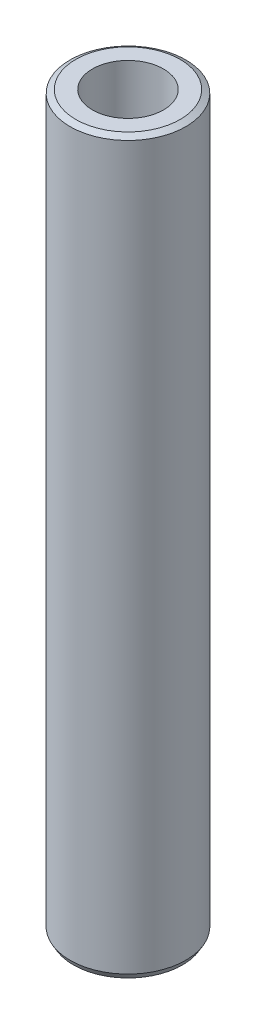
from build123d import *
from OCP.BRepFilletAPI import BRepFilletAPI_MakeChamfer

# Parameters (mm, degrees)
SKETCH1_R           = 47.5
BOSS_EXTRUDE1_DEPTH = 600
SKETCH2_R           = 29.17581862
CUT_EXTRUDE1_DEPTH  = 604.748706003
CHAMFER1_SIZE       = 2.716349708
CHAMFER1_SIZE2      = 4.704855705


with BuildPart() as part:
    # Sketch1 → Boss-Extrude1 (new body)
    with BuildSketch(Plane(origin=(0, 0, 0), x_dir=(1, 0, 0), z_dir=(0, 1, 0))):
        Circle(SKETCH1_R)
    extrude(amount=BOSS_EXTRUDE1_DEPTH)

    # Sketch2 → Cut-Extrude1 (cut, through all)
    with BuildSketch(Plane(origin=(0, 0, 0), x_dir=(1, 0, 0), z_dir=(0, 1, 0))):
        Circle(SKETCH2_R)
    extrude(amount=CUT_EXTRUDE1_DEPTH, mode=Mode.SUBTRACT)

    # Chamfer1: one chamfer whose edges measure the first distance from different faces: ONE call of the kernel's chamfer builder (chamfer() names one face for all edges)
    chamfer1_edges_1 = [part.edges().sort_by_distance(p)[0] for p in [
        (-47.5, 600, 0),
    ]]
    chamfer1_side_1 = [part.faces().sort_by_distance(p)[0] for p in [
        (-47.5, 300, 0),
    ]]
    chamfer1_edges_2 = [part.edges().sort_by_distance(p)[0] for p in [
        (-47.5, 0, 0),
    ]]
    chamfer1_side_2 = [part.faces().sort_by_distance(p)[0] for p in [
        (-46.156497116, 0, 0),
    ]]
    chamfer1 = BRepFilletAPI_MakeChamfer(part.part.solid().wrapped)
    for e in chamfer1_edges_1:
        chamfer1.Add(CHAMFER1_SIZE, CHAMFER1_SIZE2, e.wrapped, chamfer1_side_1[0].wrapped)  # the first distance lies on this face
    for e in chamfer1_edges_2:
        chamfer1.Add(CHAMFER1_SIZE, CHAMFER1_SIZE2, e.wrapped, chamfer1_side_2[0].wrapped)  # the first distance lies on this face
    add(Compound.cast(chamfer1.Shape()), mode=Mode.REPLACE)


solid = part.part
